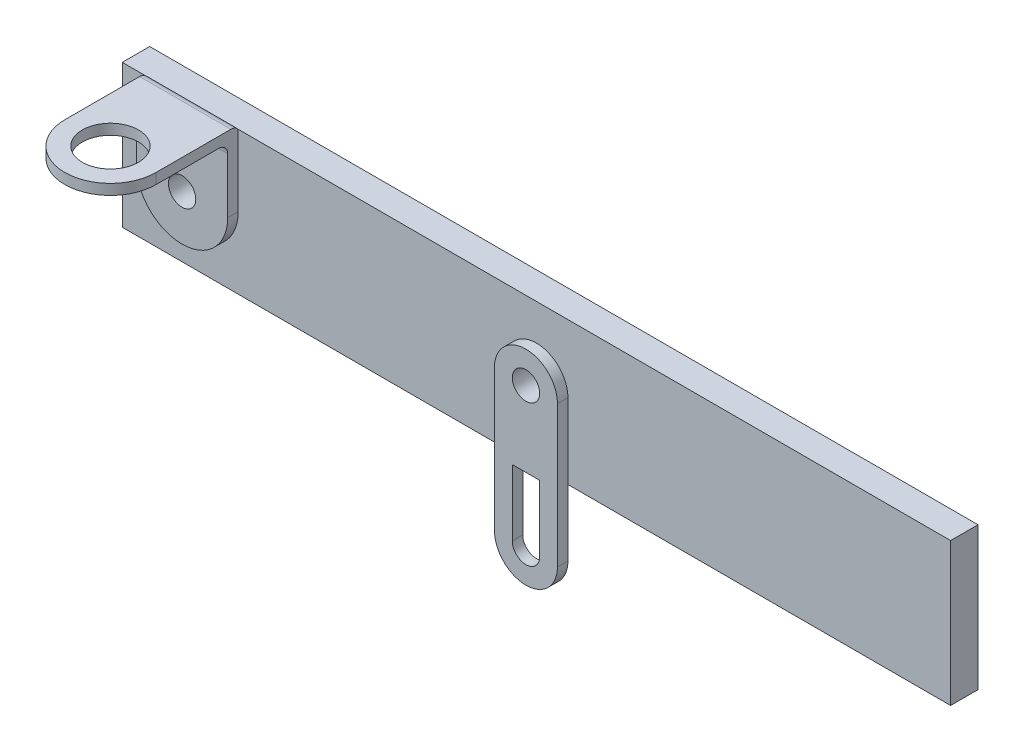
from build123d import *

# Parameters (mm, degrees)
SKETCH_1_W          = 46.101
SKETCH_1_H          = 7.9502
EXTRUDE_1_DEPTH     = 1.524
EXTRUDE_2_DEPTH     = 0.5842
SKETCH_3_R          = 1.5621
EXTRUDE_3_DEPTH     = 0.5842
FILLET_1_R          = 0.508
SKETCH_4_R          = 0.762
CUT_EXTRUDE_4_DEPTH = 26.241699688
EXTRUDE_5_DEPTH     = 0.5842
SKETCH_6_R          = 0.762
CUT_EXTRUDE_6_DEPTH = 28.442983889


with BuildPart() as part:
    # 草圖1 → 伸長1 (new body)
    with BuildSketch(Plane.XY):
        with Locations((0, -3.9751)):
            Rectangle(SKETCH_1_W, SKETCH_1_H)
    extrude(amount=EXTRUDE_1_DEPTH)

    # 草圖2 → 伸長2 (add)
    with BuildSketch(Plane.XY.offset(1.524)):
        with BuildLine():
            Line((-21.6789, -0.381), (-21.6789, -3.9751))
            ThreePointArc((-21.6789, -3.9751), (-19.1389, -6.5151), (-16.5989, -3.9751))
            Line((-16.5989, -3.9751), (-16.5989, -0.381))
            Line((-16.5989, -0.381), (-21.6789, -0.381))
        make_face()
    extrude(amount=EXTRUDE_2_DEPTH)

    # 草圖3 → 伸長3 (add)
    with BuildSketch(Plane(origin=(0, -0.381, 0), x_dir=(1, 0, 0), z_dir=(0, 1, 0))):
        with BuildLine():
            Line((-16.5989, -1.524), (-21.6789, -1.524))
            Line((-21.6789, -1.524), (-21.6789, -6.096))
            ThreePointArc((-21.6789, -6.096), (-19.1389, -8.636), (-16.5989, -6.096))
            Line((-16.5989, -6.096), (-16.5989, -1.524))
        make_face()
        with Locations(Location((-19.1389, -6.096, 0), (0, 0, 180))):
            Circle(SKETCH_3_R, mode=Mode.SUBTRACT)
    extrude(amount=EXTRUDE_3_DEPTH)

    # 圓角1
    # the kernel refuses this fillet: 0.508 mm, written as the material it adds along each edge
    with BuildSketch(Plane(origin=(-16.5989, -0.381, 2.1082), x_dir=(0, 0, 1), z_dir=(-1, 0, 0))) as fillet_1_piece_1:
        with BuildLine():
            CenterArc((FILLET_1_R, -FILLET_1_R), FILLET_1_R, 90, 90)
            Line((0, -FILLET_1_R), (0, 0))
            Line((0, 0), (FILLET_1_R, 0))
        make_face()
    extrude(amount=5.08)
    # the kernel refuses this fillet: 0.508 mm, written as the material it takes off along each edge
    with BuildSketch(Plane(origin=(-15.5829, 0.2032, 1.524), x_dir=(0, -1.0, 2.6096797513364413e-11), z_dir=(-1, 0, 0))) as fillet_1_2_piece_1:
        with BuildLine():
            CenterArc((0.508, 0.4064), FILLET_1_R, 179.999999999, 53.130102355)
            Line((0, 0.4064), (0, 0))
            Line((0, 0), (0.2032, 0))
        make_face()
    extrude(amount=7.112, mode=Mode.SUBTRACT)

    # 草圖4 → 伸長4 (cut, through all)
    with BuildSketch(Plane.XY.offset(2.1082)):
        with Locations((-19.1389, -3.9751)):
            Circle(SKETCH_4_R)
    extrude(amount=-CUT_EXTRUDE_4_DEPTH, mode=Mode.SUBTRACT)

    # 草圖5 → 伸長5 (add)
    with BuildSketch(Plane.XY.offset(1.524)):
        with BuildLine():
            Line((-1.7526, -11.6332), (-1.7526, -3.7592))
            ThreePointArc((-1.7526, -3.7592), (0, -2.0066), (1.7526, -3.7592))
            Line((1.7526, -3.7592), (1.7526, -11.6332))
            ThreePointArc((1.7526, -11.6332), (0, -13.3858), (-1.7526, -11.6332))
        make_face()
        with BuildLine():
            Line((-0.762, -7.9502), (-0.762, -11.6332))
            ThreePointArc((-0.762, -11.6332), (0, -12.3952), (0.762, -11.6332))
            Line((0.762, -11.6332), (0.762, -7.9502))
            Line((0.762, -7.9502), (-0.762, -7.9502))
        make_face(mode=Mode.SUBTRACT)
    extrude(amount=EXTRUDE_5_DEPTH)

    # 草圖6 → 伸長6 (cut, through all)
    with BuildSketch(Plane.XY.offset(2.1082)):
        with Locations((0, -3.7592)):
            Circle(SKETCH_6_R)
    extrude(amount=-CUT_EXTRUDE_6_DEPTH, mode=Mode.SUBTRACT)


solid = part.part
